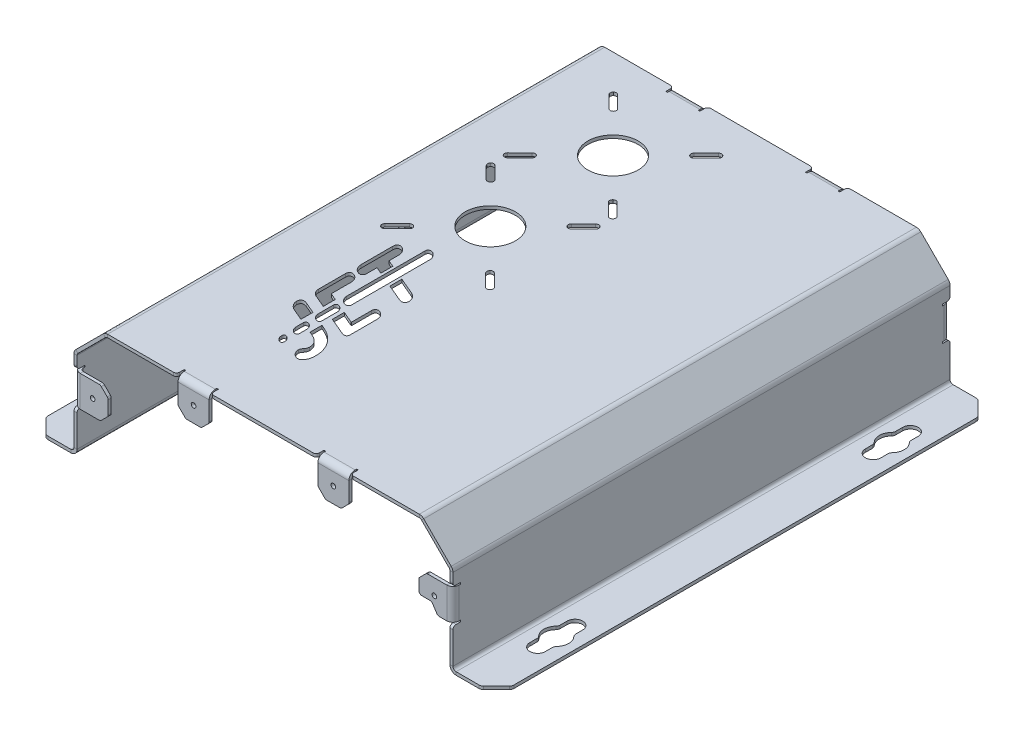
from build123d import *

# Parameters (mm, degrees)
BASE_FLANGE1_DEPTH              = 80
BREAK_CORNER1_START             = -1
BREAK_CORNER1_DEPTH             = 1
CUT_EXTRUDE1_DEPTH              = 10
FILLET1_R                       = 1.5
EDGE_FLANGE2_STRIP_W            = 6
EDGE_FLANGE2_STRIP_H            = 1
EDGE_FLANGE2_STRIP_CUT_DEPTH    = 10
EDGE_FLANGE2_RELIEF_W           = 6.5
EDGE_FLANGE2_RELIEF_H           = 0.5
EDGE_FLANGE2_RELIEF_CUT_DEPTH   = 1
EDGE_FLANGE2_STRIP_2_W          = 6
EDGE_FLANGE2_STRIP_2_H          = 1
EDGE_FLANGE2_STRIP_CUT_2_DEPTH  = 10
EDGE_FLANGE2_RELIEF_2_W         = 6.5
EDGE_FLANGE2_RELIEF_2_H         = 0.5
EDGE_FLANGE2_RELIEF_CUT_2_DEPTH = 1
EDGE_FLANGE2_STRIP_3_W          = 6
EDGE_FLANGE2_STRIP_3_H          = 1
EDGE_FLANGE2_STRIP_CUT_3_DEPTH  = 10
EDGE_FLANGE2_RELIEF_3_W         = 6.5
EDGE_FLANGE2_RELIEF_3_H         = 0.5
EDGE_FLANGE2_RELIEF_CUT_3_DEPTH = 1
EDGE_FLANGE2_DEPTH              = 10
EDGE_FLANGE2_FLAT_DEPTH         = 1
EDGE_FLANGE2_BEND_DEPTH         = 10
EDGE_FLANGE2_FLAT_2_DEPTH       = 1
EDGE_FLANGE2_BEND_2_DEPTH       = 10
EDGE_FLANGE2_FLAT_3_DEPTH       = 1
EDGE_FLANGE3_STRIP_W            = 6
EDGE_FLANGE3_STRIP_H            = 1
EDGE_FLANGE3_STRIP_CUT_DEPTH    = 10
EDGE_FLANGE3_RELIEF_W           = 6.5
EDGE_FLANGE3_RELIEF_H           = 0.5
EDGE_FLANGE3_RELIEF_CUT_DEPTH   = 1
EDGE_FLANGE3_DEPTH              = 10
EDGE_FLANGE3_FLAT_DEPTH         = 1
BREAK_CORNER2_START             = 37
BREAK_CORNER2_DEPTH             = 1
BREAK_CORNER2_START_2           = -80
BREAK_CORNER2_2_DEPTH           = 160
BREAK_CORNER2_START_3           = -61
BREAK_CORNER2_3_DEPTH           = 122
F_1_5_1_5_DIAMETER_HOLE1_D      = 1.5
CUT_EXTRUDE2_DEPTH              = 181.74567768
BREAK_CORNER3_START             = -80
BREAK_CORNER3_DEPTH             = 160
FILLET2_R                       = 1
CUT_EXTRUDE3_DEPTH              = 10
BREAK_CORNER4_START             = -1
BREAK_CORNER4_DEPTH             = 1
SKETCH48_W                      = 28
SKETCH48_H                      = 9
CUT_EXTRUDE4_DEPTH              = 10
SKETCH49_R                      = 8.1
CUT_EXTRUDE5_DEPTH              = 10
FILLET3_R                       = 1


# Read off the part's stored shape, not the designer's step: Break-Corner1, Break-Corner2, Break-Corner3, Break-Corner4
# Sheet-metal steps are written as plain solids
with BuildPart() as part:
    # Sketch1 → Base-Flange1 (new, symmetric)
    with BuildSketch(Plane.XY):
        with BuildLine():
            Line((-75, 0), (-62, 0))
            ThreePointArc((-62, 0), (-61.292893219, 0.292893219), (-61, 1))
            Line((-61, 1), (-61, 27.171572875))
            ThreePointArc((-61, 27.171572875), (-60.847759065, 27.93693974), (-60.414213562, 28.585786438))
            Line((-60.414213562, 28.585786438), (-51.585786438, 37.414213562))
            ThreePointArc((-51.585786438, 37.414213562), (-50.93693974, 37.847759065), (-50.171572875, 38))
            Line((-50.171572875, 38), (50.171572875, 38))
            ThreePointArc((50.171572875, 38), (50.93693974, 37.847759065), (51.585786438, 37.414213562))
            Line((51.585786438, 37.414213562), (60.414213562, 28.585786438))
            ThreePointArc((60.414213562, 28.585786438), (60.847759065, 27.93693974), (61, 27.171572875))
            Line((61, 27.171572875), (61, 1))
            ThreePointArc((61, 1), (61.292893219, 0.292893219), (62, 0))
            Line((62, 0), (75, 0))
            Line((75, 0), (75, -1))
            Line((75, -1), (62, -1))
            ThreePointArc((62, -1), (60.585786438, -0.414213562), (60, 1))
            Line((60, 1), (60, 27.171572875))
            ThreePointArc((60, 27.171572875), (59.923879533, 27.554256308), (59.707106781, 27.878679656))
            Line((59.707106781, 27.878679656), (50.878679656, 36.707106781))
            ThreePointArc((50.878679656, 36.707106781), (50.554256308, 36.923879533), (50.171572875, 37))
            Line((50.171572875, 37), (-50.171572875, 37))
            ThreePointArc((-50.171572875, 37), (-50.554256308, 36.923879533), (-50.878679656, 36.707106781))
            Line((-50.878679656, 36.707106781), (-59.707106781, 27.878679656))
            ThreePointArc((-59.707106781, 27.878679656), (-59.923879533, 27.554256308), (-60, 27.171572875))
            Line((-60, 27.171572875), (-60, 1))
            ThreePointArc((-60, 1), (-60.585786438, -0.414213562), (-62, -1))
            Line((-62, -1), (-75, -1))
            Line((-75, -1), (-75, 0))
        make_face()
    extrude(amount=BASE_FLANGE1_DEPTH, both=True)

    # Break-Corner1 outline → Break-Corner1 (cut)
    with BuildSketch(Plane(origin=(0, 0, 0), x_dir=(1, 0, 0), z_dir=(0, 1, 0)).offset(BREAK_CORNER1_START)):
        Polygon((75, -80), (75, -75), (70, -80), align=None)
        Polygon((70, 80), (75, 75), (75, 80), align=None)
        Polygon((-75, 80), (-75, 75), (-70, 80), align=None)
        Polygon((-70, -80), (-75, -75), (-75, -80), align=None)
    extrude(amount=BREAK_CORNER1_DEPTH, mode=Mode.SUBTRACT)

    # Sketch2 → Cut-Extrude1 (cut)
    with BuildSketch(Plane.XZ):
        with BuildLine():
            ThreePointArc((70.75, 50.877501001), (72.25, 54), (70.75, 57.122498999))
            Line((70.75, 57.122498999), (70.75, 60))
            ThreePointArc((70.75, 60), (68.25, 62.5), (65.75, 60))
            Line((65.75, 60), (65.75, 57.122498999))
            ThreePointArc((65.75, 57.122498999), (64.25, 54), (65.75, 50.877501001))
            Line((65.75, 50.877501001), (65.75, 48))
            ThreePointArc((65.75, 48), (68.25, 45.5), (70.75, 48))
            Line((70.75, 48), (70.75, 50.877501001))
        make_face()
        with BuildLine():
            Line((70.75, -60), (70.75, -57.122498999))
            ThreePointArc((70.75, -57.122498999), (72.25, -54), (70.75, -50.877501001))
            Line((70.75, -50.877501001), (70.75, -48))
            ThreePointArc((70.75, -48), (68.25, -45.5), (65.75, -48))
            Line((65.75, -48), (65.75, -50.877501001))
            ThreePointArc((65.75, -50.877501001), (64.25, -54), (65.75, -57.122498999))
            Line((65.75, -57.122498999), (65.75, -60))
            ThreePointArc((65.75, -60), (68.25, -62.5), (70.75, -60))
        make_face()
        with BuildLine():
            Line((-70.75, 60), (-70.75, 57.122498999))
            ThreePointArc((-70.75, 57.122498999), (-72.25, 54), (-70.75, 50.877501001))
            Line((-70.75, 50.877501001), (-70.75, 48))
            ThreePointArc((-70.75, 48), (-68.25, 45.5), (-65.75, 48))
            Line((-65.75, 48), (-65.75, 50.877501001))
            ThreePointArc((-65.75, 50.877501001), (-64.25, 54), (-65.75, 57.122498999))
            Line((-65.75, 57.122498999), (-65.75, 60))
            ThreePointArc((-65.75, 60), (-68.25, 62.5), (-70.75, 60))
        make_face()
        with BuildLine():
            ThreePointArc((-70.75, -50.877501001), (-72.25, -54), (-70.75, -57.122498999))
            Line((-70.75, -57.122498999), (-70.75, -60))
            ThreePointArc((-70.75, -60), (-68.25, -62.5), (-65.75, -60))
            Line((-65.75, -60), (-65.75, -57.122498999))
            ThreePointArc((-65.75, -57.122498999), (-64.25, -54), (-65.75, -50.877501001))
            Line((-65.75, -50.877501001), (-65.75, -48))
            ThreePointArc((-65.75, -48), (-68.25, -45.5), (-70.75, -48))
            Line((-70.75, -48), (-70.75, -50.877501001))
        make_face()
    extrude(amount=CUT_EXTRUDE1_DEPTH, mode=Mode.SUBTRACT)

    # Fillet1
    fillet1_edges = [part.edges().sort_by_distance(p)[0] for p in [
        (70.75, -0.5, -57.122498999),
        (70.75, -0.5, -50.877501001),
        (65.75, -0.5, -50.877501001),
        (65.75, -0.5, -57.122498999),
        (-70.75, -0.5, 57.122498999),
        (-70.75, -0.5, 50.877501001),
        (-65.75, -0.5, 50.877501001),
        (-65.75, -0.5, 57.122498999),
        (-70.75, -0.5, -50.877501001),
        (-70.75, -0.5, -57.122498999),
        (-65.75, -0.5, -57.122498999),
        (-65.75, -0.5, -50.877501001),
        (70.75, -0.5, 50.877501001),
        (70.75, -0.5, 57.122498999),
        (65.75, -0.5, 57.122498999),
        (65.75, -0.5, 50.877501001),
    ]]
    fillet(fillet1_edges, radius=FILLET1_R)

    # Edge-Flange2 strip (across the edge) → Edge-Flange2 strip cut (cut)
    with BuildSketch(Plane(origin=(17.5, 37, -80), x_dir=(0, 0, 1), z_dir=(1, 0, 0))):
        with Locations((-1, -0.5)):
            Rectangle(EDGE_FLANGE2_STRIP_W, EDGE_FLANGE2_STRIP_H)
    edge_flange2_strip_cut = extrude(amount=EDGE_FLANGE2_STRIP_CUT_DEPTH, mode=Mode.SUBTRACT)

    # Edge-Flange2 relief (on the sheet) → Edge-Flange2 relief cut (cut)
    with BuildSketch(Plane(origin=(17.5, 37, -78), x_dir=(0, 0, 1), z_dir=(0, -1, 0))):
        with Locations((-2.75, 0.25)):
            Rectangle(EDGE_FLANGE2_RELIEF_W, EDGE_FLANGE2_RELIEF_H)
        with Locations((-2.75, -10.25)):
            Rectangle(EDGE_FLANGE2_RELIEF_W, EDGE_FLANGE2_RELIEF_H)
    edge_flange2_relief_cut = extrude(amount=-EDGE_FLANGE2_RELIEF_CUT_DEPTH, mode=Mode.SUBTRACT)

    # Edge-Flange2 strip 2 (across the edge) → Edge-Flange2 strip cut 2 (cut)
    with BuildSketch(Plane(origin=(60, 22.671572875, -80), x_dir=(0, 0, 1), z_dir=(0, -1, 0))):
        with Locations((-1, -0.5)):
            Rectangle(EDGE_FLANGE2_STRIP_2_W, EDGE_FLANGE2_STRIP_2_H)
    edge_flange2_strip_cut_2 = extrude(amount=EDGE_FLANGE2_STRIP_CUT_2_DEPTH, mode=Mode.SUBTRACT)

    # Edge-Flange2 relief 2 (on the sheet) → Edge-Flange2 relief cut 2 (cut)
    with BuildSketch(Plane(origin=(60, 22.671572875, -78), x_dir=(0, 0, 1), z_dir=(-1, 0, 0))):
        with Locations((-2.75, 0.25)):
            Rectangle(EDGE_FLANGE2_RELIEF_2_W, EDGE_FLANGE2_RELIEF_2_H)
        with Locations((-2.75, -10.25)):
            Rectangle(EDGE_FLANGE2_RELIEF_2_W, EDGE_FLANGE2_RELIEF_2_H)
    edge_flange2_relief_cut_2 = extrude(amount=-EDGE_FLANGE2_RELIEF_CUT_2_DEPTH, mode=Mode.SUBTRACT)

    # Edge-Flange2 strip 3 (across the edge) → Edge-Flange2 strip cut 3 (cut)
    with BuildSketch(Plane(origin=(-60, 12.671572875, -80), x_dir=(0, 0, 1), z_dir=(0, 1, 0))):
        with Locations((-1, -0.5)):
            Rectangle(EDGE_FLANGE2_STRIP_3_W, EDGE_FLANGE2_STRIP_3_H)
    edge_flange2_strip_cut_3 = extrude(amount=EDGE_FLANGE2_STRIP_CUT_3_DEPTH, mode=Mode.SUBTRACT)

    # Edge-Flange2 relief 3 (on the sheet) → Edge-Flange2 relief cut 3 (cut)
    with BuildSketch(Plane(origin=(-60, 12.671572875, -78), x_dir=(0, 0, 1), z_dir=(1, 0, 0))):
        with Locations((-2.75, 0.25)):
            Rectangle(EDGE_FLANGE2_RELIEF_3_W, EDGE_FLANGE2_RELIEF_3_H)
        with Locations((-2.75, -10.25)):
            Rectangle(EDGE_FLANGE2_RELIEF_3_W, EDGE_FLANGE2_RELIEF_3_H)
    edge_flange2_relief_cut_3 = extrude(amount=-EDGE_FLANGE2_RELIEF_CUT_3_DEPTH, mode=Mode.SUBTRACT)

    # Edge-Flange2 bend section (across the edge) → Edge-Flange2 (add)
    with BuildSketch(Plane(origin=(17.5, 37, -80), x_dir=(0, 0, 1), z_dir=(1, 0, 0))):
        with BuildLine():
            Line((0, 1), (1, 1))
            ThreePointArc((1, 1), (1.292893219, 0.292893219), (2, 0))
            Line((2, 0), (2, -1))
            ThreePointArc((2, -1), (0.585786438, -0.414213562), (0, 1))
        make_face()
    edge_flange2 = extrude(amount=EDGE_FLANGE2_DEPTH)

    # Edge-Flange2 profile (on flange) → Edge-Flange2 flat (add)
    with BuildSketch(Plane(origin=(0, 37, -80), x_dir=(1, 0, 0), z_dir=(0, 0, -1))):
        Polygon((17.5, 7.5), (17.5, 1), (27.5, 1), (27.5, 7.5), (25, 10), (20, 10), align=None)
    edge_flange2_flat = extrude(amount=-EDGE_FLANGE2_FLAT_DEPTH)

    # Edge-Flange2 bend section 2 (across the edge) → Edge-Flange2 bend (add)
    with BuildSketch(Plane(origin=(60, 22.671572875, -80), x_dir=(0, 0, 1), z_dir=(0, -1, 0))):
        with BuildLine():
            Line((0, 1), (1, 1))
            ThreePointArc((1, 1), (1.292893219, 0.292893219), (2, 0))
            Line((2, 0), (2, -1))
            ThreePointArc((2, -1), (0.585786438, -0.414213562), (0, 1))
        make_face()
    edge_flange2_bend = extrude(amount=EDGE_FLANGE2_BEND_DEPTH)

    # Edge-Flange2 profile 2 (on flange) → Edge-Flange2 flat 2 (add)
    with BuildSketch(Plane(origin=(60, 0, -80), x_dir=(0, -1, 0), z_dir=(0, 0, -1))):
        Polygon((-22.671572875, 7.5), (-22.671572875, 1), (-12.671572875, 1), (-12.671572875, 7.5), (-15.171572875, 10), (-20.171572875, 10), align=None)
    edge_flange2_flat_2 = extrude(amount=-EDGE_FLANGE2_FLAT_2_DEPTH)

    # Edge-Flange2 bend section 3 (across the edge) → Edge-Flange2 bend 2 (add)
    with BuildSketch(Plane(origin=(-60, 12.671572875, -80), x_dir=(0, 0, 1), z_dir=(0, 1, 0))):
        with BuildLine():
            Line((0, 1), (1, 1))
            ThreePointArc((1, 1), (1.292893219, 0.292893219), (2, 0))
            Line((2, 0), (2, -1))
            ThreePointArc((2, -1), (0.585786438, -0.414213562), (0, 1))
        make_face()
    edge_flange2_bend_2 = extrude(amount=EDGE_FLANGE2_BEND_2_DEPTH)

    # Edge-Flange2 profile 3 (on flange) → Edge-Flange2 flat 3 (add)
    with BuildSketch(Plane(origin=(-60, 0, -80), x_dir=(0, 1, 0), z_dir=(0, 0, -1))):
        Polygon((12.671572875, 7.5), (12.671572875, 1), (22.671572875, 1), (22.671572875, 7.5), (20.171572875, 10), (15.171572875, 10), align=None)
    edge_flange2_flat_3 = extrude(amount=-EDGE_FLANGE2_FLAT_3_DEPTH)

    # Edge-Flange3 strip (across the edge) → Edge-Flange3 strip cut (cut)
    with BuildSketch(Plane(origin=(-27.5, 37, -80), x_dir=(0, 0, 1), z_dir=(1, 0, 0))):
        with Locations((-1, -0.5)):
            Rectangle(EDGE_FLANGE3_STRIP_W, EDGE_FLANGE3_STRIP_H)
    edge_flange3_strip_cut = extrude(amount=EDGE_FLANGE3_STRIP_CUT_DEPTH, mode=Mode.SUBTRACT)

    # Edge-Flange3 relief (on the sheet) → Edge-Flange3 relief cut (cut)
    with BuildSketch(Plane(origin=(-27.5, 37, -78), x_dir=(0, 0, 1), z_dir=(0, -1, 0))):
        with Locations((-2.75, 0.25)):
            Rectangle(EDGE_FLANGE3_RELIEF_W, EDGE_FLANGE3_RELIEF_H)
        with Locations((-2.75, -10.25)):
            Rectangle(EDGE_FLANGE3_RELIEF_W, EDGE_FLANGE3_RELIEF_H)
    edge_flange3_relief_cut = extrude(amount=-EDGE_FLANGE3_RELIEF_CUT_DEPTH, mode=Mode.SUBTRACT)

    # Edge-Flange3 bend section (across the edge) → Edge-Flange3 (add)
    with BuildSketch(Plane(origin=(-27.5, 37, -80), x_dir=(0, 0, 1), z_dir=(1, 0, 0))):
        with BuildLine():
            Line((0, 1), (1, 1))
            ThreePointArc((1, 1), (1.292893219, 0.292893219), (2, 0))
            Line((2, 0), (2, -1))
            ThreePointArc((2, -1), (0.585786438, -0.414213562), (0, 1))
        make_face()
    edge_flange3 = extrude(amount=EDGE_FLANGE3_DEPTH)

    # Edge-Flange3 profile (on flange) → Edge-Flange3 flat (add)
    with BuildSketch(Plane(origin=(0, 37, -80), x_dir=(1, 0, 0), z_dir=(0, 0, -1))):
        Polygon((-27.5, 1), (-17.5, 1), (-17.5, 7.5), (-20, 10), (-25, 10), (-27.5, 7.5), align=None)
    edge_flange3_flat = extrude(amount=-EDGE_FLANGE3_FLAT_DEPTH)

    # Mirror1: Edge-Flange2 strip cut, Edge-Flange2 relief cut, Edge-Flange2 strip cut 2, Edge-Flange2 relief cut 2, Edge-Flange2 strip cut 3, Edge-Flange2 relief cut 3, Edge-Flange2, Edge-Flange2 flat, Edge-Flange2 bend, Edge-Flange2 flat 2, Edge-Flange2 bend 2, Edge-Flange2 flat 3, Edge-Flange3 strip cut, Edge-Flange3 relief cut, Edge-Flange3, Edge-Flange3 flat across plane
    add(edge_flange2_strip_cut.mirror(Plane.XY), mode=Mode.SUBTRACT)
    add(edge_flange2_relief_cut.mirror(Plane.XY), mode=Mode.SUBTRACT)
    add(edge_flange2_strip_cut_2.mirror(Plane.XY), mode=Mode.SUBTRACT)
    add(edge_flange2_relief_cut_2.mirror(Plane.XY), mode=Mode.SUBTRACT)
    add(edge_flange2_strip_cut_3.mirror(Plane.XY), mode=Mode.SUBTRACT)
    add(edge_flange2_relief_cut_3.mirror(Plane.XY), mode=Mode.SUBTRACT)
    add(edge_flange2.mirror(Plane.XY))
    add(edge_flange2_flat.mirror(Plane.XY))
    add(edge_flange2_bend.mirror(Plane.XY))
    add(edge_flange2_flat_2.mirror(Plane.XY))
    add(edge_flange2_bend_2.mirror(Plane.XY))
    add(edge_flange2_flat_3.mirror(Plane.XY))
    add(edge_flange3_strip_cut.mirror(Plane.XY), mode=Mode.SUBTRACT)
    add(edge_flange3_relief_cut.mirror(Plane.XY), mode=Mode.SUBTRACT)
    add(edge_flange3.mirror(Plane.XY))
    add(edge_flange3_flat.mirror(Plane.XY))

    # Break-Corner2 outline → Break-Corner2 (cut)
    with BuildSketch(Plane(origin=(0, 0, 0), x_dir=(1, 0, 0), z_dir=(0, 1, 0)).offset(BREAK_CORNER2_START)):
        with BuildLine():
            Line((-17, -80), (-16, -80))
            ThreePointArc((-16, -80), (-16.707106781, -79.707106781), (-17, -79))
            Line((-17, -79), (-17, -80))
        make_face()
        with BuildLine():
            ThreePointArc((17, -79), (16.707106781, -79.707106781), (16, -80))
            Line((16, -80), (17, -80))
            Line((17, -80), (17, -79))
        make_face()
        with BuildLine():
            ThreePointArc((29, -80), (28.292893219, -79.707106781), (28, -79))
            Line((28, -79), (28, -80))
            Line((28, -80), (29, -80))
        make_face()
        with BuildLine():
            ThreePointArc((-28, -79), (-28.292893219, -79.707106781), (-29, -80))
            Line((-29, -80), (-28, -80))
            Line((-28, -80), (-28, -79))
        make_face()
        with BuildLine():
            ThreePointArc((-29, 80), (-28.292893219, 79.707106781), (-28, 79))
            Line((-28, 79), (-28, 80))
            Line((-28, 80), (-29, 80))
        make_face()
        with BuildLine():
            Line((17, 80), (16, 80))
            ThreePointArc((16, 80), (16.707106781, 79.707106781), (17, 79))
            Line((17, 79), (17, 80))
        make_face()
        with BuildLine():
            ThreePointArc((-17, 79), (-16.707106781, 79.707106781), (-16, 80))
            Line((-16, 80), (-17, 80))
            Line((-17, 80), (-17, 79))
        make_face()
        with BuildLine():
            ThreePointArc((28, 79), (28.292893219, 79.707106781), (29, 80))
            Line((29, 80), (28, 80))
            Line((28, 80), (28, 79))
        make_face()
    extrude(amount=BREAK_CORNER2_DEPTH, mode=Mode.SUBTRACT)

    # Break-Corner2 2 outline → Break-Corner2 2 (cut)
    with BuildSketch(Plane.XY.offset(BREAK_CORNER2_START_2)):
        with BuildLine():
            Line((52.5, 12.671572875), (52.914213562, 12.671572875))
            ThreePointArc((52.914213562, 12.671572875), (52.53153013, 12.747693343), (52.207106781, 12.964466094))
            Line((52.207106781, 12.964466094), (52.5, 12.671572875))
        make_face()
        with BuildLine():
            Line((52.5, 22.671572875), (52.207106781, 22.378679656))
            ThreePointArc((52.207106781, 22.378679656), (52.53153013, 22.595452408), (52.914213562, 22.671572875))
            Line((52.914213562, 22.671572875), (52.5, 22.671572875))
        make_face()
        with BuildLine():
            Line((50, 20.171572875), (50, 19.757359313))
            ThreePointArc((50, 19.757359313), (50.076120467, 20.140042745), (50.292893219, 20.464466094))
            Line((50.292893219, 20.464466094), (50, 20.171572875))
        make_face()
        with BuildLine():
            Line((50, 15.171572875), (50.292893219, 14.878679656))
            ThreePointArc((50.292893219, 14.878679656), (50.076120467, 15.203103005), (50, 15.585786438))
            Line((50, 15.585786438), (50, 15.171572875))
        make_face()
        with BuildLine():
            Line((27.5, 29.5), (27.5, 29.914213562))
            ThreePointArc((27.5, 29.914213562), (27.423879533, 29.53153013), (27.207106781, 29.207106781))
            Line((27.207106781, 29.207106781), (27.5, 29.5))
        make_face()
        with BuildLine():
            Line((17.5, 29.5), (17.792893219, 29.207106781))
            ThreePointArc((17.792893219, 29.207106781), (17.576120467, 29.53153013), (17.5, 29.914213562))
            Line((17.5, 29.914213562), (17.5, 29.5))
        make_face()
        with BuildLine():
            Line((20, 27), (20.414213562, 27))
            ThreePointArc((20.414213562, 27), (20.03153013, 27.076120467), (19.707106781, 27.292893219))
            Line((19.707106781, 27.292893219), (20, 27))
        make_face()
        with BuildLine():
            Line((25, 27), (25.292893219, 27.292893219))
            ThreePointArc((25.292893219, 27.292893219), (24.96846987, 27.076120467), (24.585786438, 27))
            Line((24.585786438, 27), (25, 27))
        make_face()
        with BuildLine():
            Line((-17.5, 29.5), (-17.5, 29.914213562))
            ThreePointArc((-17.5, 29.914213562), (-17.576120467, 29.53153013), (-17.792893219, 29.207106781))
            Line((-17.792893219, 29.207106781), (-17.5, 29.5))
        make_face()
        with BuildLine():
            Line((-27.5, 29.5), (-27.207106781, 29.207106781))
            ThreePointArc((-27.207106781, 29.207106781), (-27.423879533, 29.53153013), (-27.5, 29.914213562))
            Line((-27.5, 29.914213562), (-27.5, 29.5))
        make_face()
        with BuildLine():
            Line((-25, 27), (-24.585786438, 27))
            ThreePointArc((-24.585786438, 27), (-24.96846987, 27.076120467), (-25.292893219, 27.292893219))
            Line((-25.292893219, 27.292893219), (-25, 27))
        make_face()
        with BuildLine():
            Line((-20, 27), (-19.707106781, 27.292893219))
            ThreePointArc((-19.707106781, 27.292893219), (-20.03153013, 27.076120467), (-20.414213562, 27))
            Line((-20.414213562, 27), (-20, 27))
        make_face()
        with BuildLine():
            Line((-52.5, 22.671572875), (-52.914213562, 22.671572875))
            ThreePointArc((-52.914213562, 22.671572875), (-52.53153013, 22.595452408), (-52.207106781, 22.378679656))
            Line((-52.207106781, 22.378679656), (-52.5, 22.671572875))
        make_face()
        with BuildLine():
            Line((-52.5, 12.671572875), (-52.207106781, 12.964466094))
            ThreePointArc((-52.207106781, 12.964466094), (-52.53153013, 12.747693343), (-52.914213562, 12.671572875))
            Line((-52.914213562, 12.671572875), (-52.5, 12.671572875))
        make_face()
        with BuildLine():
            Line((-50, 15.171572875), (-50, 15.585786438))
            ThreePointArc((-50, 15.585786438), (-50.076120467, 15.203103005), (-50.292893219, 14.878679656))
            Line((-50.292893219, 14.878679656), (-50, 15.171572875))
        make_face()
        with BuildLine():
            Line((-50, 20.171572875), (-50.292893219, 20.464466094))
            ThreePointArc((-50.292893219, 20.464466094), (-50.076120467, 20.140042745), (-50, 19.757359313))
            Line((-50, 19.757359313), (-50, 20.171572875))
        make_face()
    extrude(amount=BREAK_CORNER2_2_DEPTH, mode=Mode.SUBTRACT)

    # Break-Corner2 3 outline → Break-Corner2 3 (cut)
    with BuildSketch(Plane.YZ.offset(BREAK_CORNER2_START_3)):
        with BuildLine():
            Line((12.171572875, -80), (12.171572875, -79))
            ThreePointArc((12.171572875, -79), (11.878679656, -79.707106781), (11.171572875, -80))
            Line((11.171572875, -80), (12.171572875, -80))
        make_face()
        with BuildLine():
            Line((23.171572875, -80), (24.171572875, -80))
            ThreePointArc((24.171572875, -80), (23.464466094, -79.707106781), (23.171572875, -79))
            Line((23.171572875, -79), (23.171572875, -80))
        make_face()
        with BuildLine():
            Line((23.171572875, 80), (23.171572875, 79))
            ThreePointArc((23.171572875, 79), (23.464466094, 79.707106781), (24.171572875, 80))
            Line((24.171572875, 80), (23.171572875, 80))
        make_face()
        with BuildLine():
            Line((12.171572875, 80), (11.171572875, 80))
            ThreePointArc((11.171572875, 80), (11.878679656, 79.707106781), (12.171572875, 79))
            Line((12.171572875, 79), (12.171572875, 80))
        make_face()
    extrude(amount=BREAK_CORNER2_3_DEPTH, mode=Mode.SUBTRACT)

    # Ø1.5 (1.5) Diameter Hole1 (through all)
    with Locations(Plane(origin=(0, 0, -80), x_dir=(-1, 0, 0), z_dir=(0, 0, -1))):
        with Locations((-22.5, 32), (-55, 17.671572875), (55, 17.671572875), (22.5, 32)):
            Hole(F_1_5_1_5_DIAMETER_HOLE1_D / 2)

    # Sketch43 → Cut-Extrude2 (cut, through all)
    with BuildSketch(Plane.XY.offset(80)):
        with BuildLine():
            Line((50, 15.671572875), (54.1, 15.671572875))
            Line((54.1, 15.671572875), (56.114213562, 12.671572875))
            Line((56.114213562, 12.671572875), (52.914213562, 12.671572875))
            ThreePointArc((52.914213562, 12.671572875), (52.53153013, 12.747693343), (52.207106781, 12.964466094))
            Line((52.207106781, 12.964466094), (50.292893219, 14.878679656))
            ThreePointArc((50.292893219, 14.878679656), (50.076120467, 15.203103005), (50, 15.585786438))
            Line((50, 15.585786438), (50, 15.671572875))
        make_face()
    extrude(amount=-CUT_EXTRUDE2_DEPTH, mode=Mode.SUBTRACT)

    # Break-Corner3 outline → Break-Corner3 (cut)
    with BuildSketch(Plane.XY.offset(BREAK_CORNER3_START)):
        with BuildLine():
            ThreePointArc((56.647294006, 12.671572875), (56.176879522, 12.789127289), (55.817063635, 13.11415245))
            Line((55.817063635, 13.11415245), (56.114213562, 12.671572875))
            Line((56.114213562, 12.671572875), (56.647294006, 12.671572875))
        make_face()
        with BuildLine():
            Line((50, 15.671572875), (51, 15.671572875))
            ThreePointArc((51, 15.671572875), (50.292893219, 15.964466094), (50, 16.671572875))
            Line((50, 16.671572875), (50, 15.671572875))
        make_face()
    extrude(amount=BREAK_CORNER3_DEPTH, mode=Mode.SUBTRACT)

    # Fillet2
    fillet2_edges = [part.edges().sort_by_distance(p)[0] for p in [
        (54.1, 15.671572875, -79.5),
        (54.1, 15.671572875, 79.5),
    ]]
    fillet(fillet2_edges, radius=FILLET2_R)

    # Sketch46 → Cut-Extrude3 (cut)
    with BuildSketch(Plane(origin=(0, 38, 0), x_dir=(1, 0, 0), z_dir=(0, 1, 0))):
        with BuildLine():
            Line((-22.2965, -5.7161), (-22.2965, -30.9521))
            add(Edge.make_bspline(
                [(-22.2965, -30.9521), (-22.2965, -31.8418), (-21.5688, -32.9225), (-20.6793, -33.354)],
                knots=[0.777777778, 0.777777778, 0.777777778, 0.777777778, 1, 1, 1, 1], degree=3))
            add(Edge.make_bspline(
                [(-20.6793, -33.354), (-19.7895, -33.7856), (-19.0618, -33.4108), (-19.0618, -32.5212)],
                knots=[0.555555556, 0.555555556, 0.555555556, 0.555555556, 0.666666667, 0.666666667, 0.666666667, 0.666666667], degree=3))
            Line((-19.0618, -32.5212), (-19.0618, -7.2852))
            add(Edge.make_bspline(
                [(-19.0618, -7.2852), (-19.0618, -6.3955), (-19.7895, -5.3148), (-20.6793, -4.8832)],
                knots=[0.333333333, 0.333333333, 0.333333333, 0.333333333, 0.444444444, 0.444444444, 0.444444444, 0.444444444], degree=3))
            add(Edge.make_bspline(
                [(-20.6793, -4.8832), (-21.5688, -4.4517), (-22.2965, -4.8264), (-22.2965, -5.7161)],
                knots=[0.111111111, 0.111111111, 0.111111111, 0.111111111, 0.222222222, 0.222222222, 0.222222222, 0.222222222], degree=3))
        make_face()
        with BuildLine():
            Line((-21.8812, -45.3084), (-21.8812, -47.7576))
            add(Edge.make_bspline(
                [(-21.8812, -47.7576), (-21.8812, -48.4187), (-21.3403, -49.2219), (-20.6793, -49.5426)],
                knots=[0.777777778, 0.777777778, 0.777777778, 0.777777778, 1, 1, 1, 1], degree=3))
            add(Edge.make_bspline(
                [(-20.6793, -49.5426), (-20.0179, -49.8634), (-19.4771, -49.5849), (-19.4771, -48.9238)],
                knots=[0.555555556, 0.555555556, 0.555555556, 0.555555556, 0.666666667, 0.666666667, 0.666666667, 0.666666667], degree=3))
            Line((-19.4771, -48.9238), (-19.4771, -46.4746))
            add(Edge.make_bspline(
                [(-19.4771, -46.4746), (-19.4771, -45.8135), (-20.0179, -45.0102), (-20.679, -44.6896)],
                knots=[0.333333333, 0.333333333, 0.333333333, 0.333333333, 0.444444444, 0.444444444, 0.444444444, 0.444444444], degree=3))
            add(Edge.make_bspline(
                [(-20.679, -44.6896), (-21.3403, -44.3688), (-21.8812, -44.6473), (-21.8812, -45.3084)],
                knots=[0.111111111, 0.111111111, 0.111111111, 0.111111111, 0.222222222, 0.222222222, 0.222222222, 0.222222222], degree=3))
        make_face()
        with BuildLine():
            Line((-21.7302, -52.3392), (-21.7302, -52.6821))
            add(Edge.make_bspline(
                [(-21.7302, -52.6821), (-21.7302, -53.2602), (-21.2573, -53.9625), (-20.6792, -54.2429)],
                knots=[0.777777778, 0.777777778, 0.777777778, 0.777777778, 1, 1, 1, 1], degree=3))
            add(Edge.make_bspline(
                [(-20.6792, -54.2429), (-20.101, -54.5234), (-19.6281, -54.2799), (-19.6281, -53.7018)],
                knots=[0.555555556, 0.555555556, 0.555555556, 0.555555556, 0.666666667, 0.666666667, 0.666666667, 0.666666667], degree=3))
            Line((-19.6281, -53.7018), (-19.6281, -53.3589))
            add(Edge.make_bspline(
                [(-19.6281, -53.3589), (-19.6281, -52.7808), (-20.101, -52.0785), (-20.679, -51.7981)],
                knots=[0.333333333, 0.333333333, 0.333333333, 0.333333333, 0.444444444, 0.444444444, 0.444444444, 0.444444444], degree=3))
            add(Edge.make_bspline(
                [(-20.679, -51.7981), (-21.2573, -51.5176), (-21.7302, -51.7611), (-21.7302, -52.3392)],
                knots=[0.111111111, 0.111111111, 0.111111111, 0.111111111, 0.222222222, 0.222222222, 0.222222222, 0.222222222], degree=3))
        make_face()
        with BuildLine():
            Line((-21.9596, -35.5348), (-21.9596, -40.5072))
            add(Edge.make_bspline(
                [(-21.9596, -40.5072), (-21.9596, -41.2114), (-21.3835, -42.067), (-20.6793, -42.4086)],
                knots=[0.777777778, 0.777777778, 0.777777778, 0.777777778, 1, 1, 1, 1], degree=3))
            add(Edge.make_bspline(
                [(-20.6793, -42.4086), (-19.9748, -42.7503), (-19.3987, -42.4537), (-19.3987, -41.7494)],
                knots=[0.555555556, 0.555555556, 0.555555556, 0.555555556, 0.666666667, 0.666666667, 0.666666667, 0.666666667], degree=3))
            Line((-19.3987, -41.7494), (-19.3987, -36.777))
            add(Edge.make_bspline(
                [(-19.3987, -36.777), (-19.3987, -36.0727), (-19.9748, -35.2171), (-20.679, -34.8755)],
                knots=[0.333333333, 0.333333333, 0.333333333, 0.333333333, 0.444444444, 0.444444444, 0.444444444, 0.444444444], degree=3))
            add(Edge.make_bspline(
                [(-20.679, -34.8755), (-21.3835, -34.5337), (-21.9596, -34.8305), (-21.9596, -35.5348)],
                knots=[0.111111111, 0.111111111, 0.111111111, 0.111111111, 0.222222222, 0.222222222, 0.222222222, 0.222222222], degree=3))
        make_face()
        with BuildLine():
            Line((-18.1512, -43.0097), (-18.1512, -46.866))
            Line((-18.1512, -46.866), (-17.0844, -47.3188))
            add(Edge.make_bspline(
                [(-17.0844, -47.3188), (-14.8806, -48.2541), (-14.0671, -49.5705), (-14.0671, -51.0399)],
                knots=[0.416666667, 0.416666667, 0.416666667, 0.416666667, 0.5, 0.5, 0.5, 0.5], degree=3))
            add(Edge.make_bspline(
                [(-14.0671, -51.0399), (-14.0671, -51.6172), (-14.2507, -52.1425), (-14.5394, -52.4395)],
                knots=[0.5, 0.5, 0.5, 0.5, 0.583333333, 0.583333333, 0.583333333, 0.583333333], degree=3))
            add(Edge.make_bspline(
                [(-14.5394, -52.4395), (-14.9326, -52.8499), (-15.1167, -53.1916), (-15.1167, -53.6639)],
                knots=[0.583333333, 0.583333333, 0.583333333, 0.583333333, 0.666666667, 0.666666667, 0.666666667, 0.666666667], degree=3))
            add(Edge.make_bspline(
                [(-15.1167, -53.6639), (-15.1167, -54.6345), (-14.4083, -55.6701), (-13.4898, -56.0597)],
                knots=[0.666666667, 0.666666667, 0.666666667, 0.666666667, 0.75, 0.75, 0.75, 0.75], degree=3))
            add(Edge.make_bspline(
                [(-13.4898, -56.0597), (-13.0175, -56.2605), (-12.5452, -56.2768), (-12.1515, -56.1029)],
                knots=[0.75, 0.75, 0.75, 0.75, 0.833333333, 0.833333333, 0.833333333, 0.833333333], degree=3))
            add(Edge.make_bspline(
                [(-12.1515, -56.1029), (-11.312, -55.7241), (-10.6561, -54.271), (-10.6561, -52.618)],
                knots=[0, 0, 0, 0, 0.083333333, 0.083333333, 0.083333333, 0.083333333], degree=3))
            add(Edge.make_bspline(
                [(-10.6561, -52.618), (-10.6561, -48.5251), (-12.965, -45.2103), (-17.3466, -43.3509)],
                knots=[0.083333333, 0.083333333, 0.083333333, 0.083333333, 0.166666667, 0.166666667, 0.166666667, 0.166666667], degree=3))
            Line((-17.3466, -43.3509), (-18.1512, -43.0097))
        make_face()
        with BuildLine():
            Line((-23.2073, -33.6757), (-25.2967, -32.7888))
            add(Edge.make_bspline(
                [(-25.2967, -32.7888), (-25.4018, -32.7446), (-25.4543, -32.6698), (-25.4543, -32.5647)],
                knots=[0.1, 0.1, 0.1, 0.1, 0.2, 0.2, 0.2, 0.2], degree=3))
            Line((-25.4543, -32.5647), (-25.4543, -26.2415))
            add(Edge.make_bspline(
                [(-25.4543, -26.2415), (-25.4543, -25.1658), (-26.1627, -24.1567), (-27.1073, -23.756)],
                knots=[0.3, 0.3, 0.3, 0.3, 0.4, 0.4, 0.4, 0.4], degree=3))
            add(Edge.make_bspline(
                [(-27.1073, -23.756), (-28.0779, -23.3441), (-28.7863, -23.7518), (-28.7863, -24.8274)],
                knots=[0.4, 0.4, 0.4, 0.4, 0.5, 0.5, 0.5, 0.5], degree=3))
            Line((-28.7863, -24.8274), (-28.7863, -33.486))
            add(Edge.make_bspline(
                [(-28.7863, -33.486), (-28.7863, -34.5352), (-28.1039, -35.4546), (-27.0808, -35.8888)],
                knots=[0.6, 0.6, 0.6, 0.6, 0.7, 0.7, 0.7, 0.7], degree=3))
            Line((-27.0808, -35.8888), (-23.2073, -37.5325))
            Line((-23.2073, -37.5325), (-23.2073, -33.6757))
        make_face()
        with BuildLine():
            Line((-18.134, -35.8279), (-18.1512, -35.82))
            Line((-18.1512, -35.82), (-18.1512, -39.6777))
            Line((-18.1512, -39.6777), (-12.6503, -42.0117))
            add(Edge.make_bspline(
                [(-12.6503, -42.0117), (-11.6272, -42.4459), (-10.9448, -42.1056), (-10.9448, -41.0565)],
                knots=[0, 0, 0, 0, 0.090909091, 0.090909091, 0.090909091, 0.090909091], degree=3))
            Line((-10.9448, -41.0565), (-10.9448, -32.3979))
            add(Edge.make_bspline(
                [(-10.9448, -32.3979), (-10.9448, -31.3222), (-11.6532, -30.313), (-12.6238, -29.9012)],
                knots=[0.181818182, 0.181818182, 0.181818182, 0.181818182, 0.272727273, 0.272727273, 0.272727273, 0.272727273], degree=3))
            add(Edge.make_bspline(
                [(-12.6238, -29.9012), (-13.5683, -29.5005), (-14.2768, -29.9082), (-14.2768, -30.9838)],
                knots=[0.272727273, 0.272727273, 0.272727273, 0.272727273, 0.363636364, 0.363636364, 0.363636364, 0.363636364], degree=3))
            Line((-14.2768, -30.9838), (-14.2768, -37.307))
            add(Edge.make_bspline(
                [(-14.2768, -37.307), (-14.2768, -37.4121), (-14.3293, -37.4423), (-14.4343, -37.3977)],
                knots=[0.454545455, 0.454545455, 0.454545455, 0.454545455, 0.545454545, 0.545454545, 0.545454545, 0.545454545], degree=3))
            Line((-14.4343, -37.3977), (-18.134, -35.8279))
        make_face()
        with BuildLine():
            Line((-23.2073, -15.1513), (-25.1917, -14.3095))
            add(Edge.make_bspline(
                [(-25.1917, -14.3095), (-25.2967, -14.2649), (-25.3493, -14.19), (-25.3493, -14.0854)],
                knots=[0.076923077, 0.076923077, 0.076923077, 0.076923077, 0.153846154, 0.153846154, 0.153846154, 0.153846154], degree=3))
            Line((-25.3493, -14.0854), (-25.3493, -11.0681))
            add(Edge.make_bspline(
                [(-25.3493, -11.0681), (-25.3493, -9.8874), (-26.0577, -8.8262), (-27.0548, -8.4032)],
                knots=[0.230769231, 0.230769231, 0.230769231, 0.230769231, 0.307692308, 0.307692308, 0.307692308, 0.307692308], degree=3))
            add(Edge.make_bspline(
                [(-27.0548, -8.4032), (-28.0779, -7.969), (-28.7863, -8.4292), (-28.7863, -9.6099)],
                knots=[0.307692308, 0.307692308, 0.307692308, 0.307692308, 0.384615385, 0.384615385, 0.384615385, 0.384615385], degree=3))
            Line((-28.7863, -9.6099), (-28.7863, -19.816))
            add(Edge.make_bspline(
                [(-28.7863, -19.816), (-28.7863, -20.9967), (-28.0779, -22.0584), (-27.0548, -22.4925)],
                knots=[0.461538462, 0.461538462, 0.461538462, 0.461538462, 0.538461538, 0.538461538, 0.538461538, 0.538461538], degree=3))
            add(Edge.make_bspline(
                [(-27.0548, -22.4925), (-26.0577, -22.9156), (-25.3493, -22.4549), (-25.3493, -21.2742)],
                knots=[0.538461538, 0.538461538, 0.538461538, 0.538461538, 0.615384615, 0.615384615, 0.615384615, 0.615384615], degree=3))
            Line((-25.3493, -21.2742), (-25.3493, -18.2569))
            add(Edge.make_bspline(
                [(-25.3493, -18.2569), (-25.3493, -18.1519), (-25.2967, -18.1221), (-25.1917, -18.1667)],
                knots=[0.692307692, 0.692307692, 0.692307692, 0.692307692, 0.769230769, 0.769230769, 0.769230769, 0.769230769], degree=3))
            Line((-25.1917, -18.1667), (-23.2073, -19.0086))
            Line((-23.2073, -19.0086), (-23.2073, -15.1513))
        make_face()
        with BuildLine():
            Line((-18.1512, -17.2965), (-18.1512, -21.1538))
            Line((-18.1512, -21.1538), (-12.8339, -23.4101))
            add(Edge.make_bspline(
                [(-12.8339, -23.4101), (-11.6007, -23.9336), (-10.7872, -23.465), (-10.7872, -22.3629)],
                knots=[0.666666667, 0.666666667, 0.666666667, 0.666666667, 1, 1, 1, 1], degree=3))
            add(Edge.make_bspline(
                [(-10.7872, -22.3629), (-10.7872, -21.2347), (-11.6007, -20.0763), (-12.8339, -19.5529)],
                knots=[0, 0, 0, 0, 0.166666667, 0.166666667, 0.166666667, 0.166666667], degree=3))
            Line((-12.8339, -19.5529), (-18.1512, -17.2965))
        make_face()
        with BuildLine():
            Line((-26.8972, -43.1557), (-23.2073, -44.7213))
            Line((-23.2073, -44.7213), (-23.2073, -40.8645))
            Line((-23.2073, -40.8645), (-26.8972, -39.2989))
            add(Edge.make_bspline(
                [(-26.8972, -39.2989), (-28.1565, -38.7643), (-28.9439, -39.2436), (-28.9439, -40.3717)],
                knots=[0.166666667, 0.166666667, 0.166666667, 0.166666667, 0.333333333, 0.333333333, 0.333333333, 0.333333333], degree=3))
            add(Edge.make_bspline(
                [(-28.9439, -40.3717), (-28.9439, -41.4739), (-28.1565, -42.6211), (-26.8972, -43.1557)],
                knots=[0.333333333, 0.333333333, 0.333333333, 0.333333333, 0.5, 0.5, 0.5, 0.5], degree=3))
        make_face()
    extrude(amount=-CUT_EXTRUDE3_DEPTH, mode=Mode.SUBTRACT)

    # Break-Corner4 outline → Break-Corner4 (cut)
    with BuildSketch(Plane(origin=(0, 0, 0), x_dir=(1, 0, 0), z_dir=(0, 1, 0)).offset(BREAK_CORNER4_START)):
        with BuildLine():
            Line((-70, 80), (-70.439339828, 79.560660172))
            ThreePointArc((-70.439339828, 79.560660172), (-69.952704805, 79.885819299), (-69.378679656, 80))
            Line((-69.378679656, 80), (-70, 80))
        make_face()
        with BuildLine():
            ThreePointArc((-69.378679656, -80), (-69.952704805, -79.885819299), (-70.439339828, -79.560660172))
            Line((-70.439339828, -79.560660172), (-70, -80))
            Line((-70, -80), (-69.378679656, -80))
        make_face()
        with BuildLine():
            ThreePointArc((-74.560660172, -75.439339828), (-74.885819299, -74.952704805), (-75, -74.378679656))
            Line((-75, -74.378679656), (-75, -75))
            Line((-75, -75), (-74.560660172, -75.439339828))
        make_face()
        with BuildLine():
            ThreePointArc((-75, 74.378679656), (-74.885819299, 74.952704805), (-74.560660172, 75.439339828))
            Line((-74.560660172, 75.439339828), (-75, 75))
            Line((-75, 75), (-75, 74.378679656))
        make_face()
        with BuildLine():
            Line((70, -80), (70.439339828, -79.560660172))
            ThreePointArc((70.439339828, -79.560660172), (69.952704805, -79.885819299), (69.378679656, -80))
            Line((69.378679656, -80), (70, -80))
        make_face()
        with BuildLine():
            ThreePointArc((69.378679656, 80), (69.952704805, 79.885819299), (70.439339828, 79.560660172))
            Line((70.439339828, 79.560660172), (70, 80))
            Line((70, 80), (69.378679656, 80))
        make_face()
        with BuildLine():
            ThreePointArc((74.560660172, 75.439339828), (74.885819299, 74.952704805), (75, 74.378679656))
            Line((75, 74.378679656), (75, 75))
            Line((75, 75), (74.560660172, 75.439339828))
        make_face()
        with BuildLine():
            ThreePointArc((75, -74.378679656), (74.885819299, -74.952704805), (74.560660172, -75.439339828))
            Line((74.560660172, -75.439339828), (75, -75))
            Line((75, -75), (75, -74.378679656))
        make_face()
    extrude(amount=BREAK_CORNER4_DEPTH, mode=Mode.SUBTRACT)

    # Sketch48 → Cut-Extrude4 (cut)
    with BuildSketch(Plane.ZY.offset(61)):
        with Locations((-21, 14.5)):
            Rectangle(SKETCH48_W, SKETCH48_H)
        with BuildLine():
            Line((14, 26), (32, 26))
            ThreePointArc((32, 26), (32.707106781, 25.707106781), (33, 25))
            Line((33, 25), (33, 18))
            ThreePointArc((33, 18), (32.707106781, 17.292893219), (32, 17))
            Line((32, 17), (14, 17))
            ThreePointArc((14, 17), (13.292893219, 17.292893219), (13, 18))
            Line((13, 18), (13, 25))
            ThreePointArc((13, 25), (13.292893219, 25.707106781), (14, 26))
        make_face()
    extrude(amount=-CUT_EXTRUDE4_DEPTH, mode=Mode.SUBTRACT)

    # Sketch49 → Cut-Extrude5 (cut)
    with BuildSketch(Plane(origin=(0, 38, 0), x_dir=(1, 0, 0), z_dir=(0, 1, 0))):
        with Locations(Location((-18.64627431, 51.164691262, 0), (0, 0, 180))):
            Circle(SKETCH49_R)
        with Locations(Location((-18.64627431, 11.664691262, 0), (0, 0, 180))):
            Circle(SKETCH49_R)
        with BuildLine():
            Line((-6.362455316, -2.113988509), (-2.441645302, -6.05914083))
            add(Edge.make_bspline(
                [(-2.441645302, -6.05914083), (-2.052255932, -6.450947719), (-1.419158963, -6.452906925), (-1.027452073, -6.063517246)],
                knots=[0, 0, 0, 0, 0.142857143, 0.142857143, 0.142857143, 0.142857143], degree=3))
            add(Edge.make_bspline(
                [(-1.027452073, -6.063517246), (-0.635645493, -5.674227876), (-0.633686287, -5.041130907), (-1.023075657, -4.649324018)],
                knots=[0.714285714, 0.714285714, 0.714285714, 0.714285714, 1, 1, 1, 1], degree=3))
            Line((-1.023075657, -4.649324018), (-4.943885671, -0.704171697))
            add(Edge.make_bspline(
                [(-4.943885671, -0.704171697), (-5.333275041, -0.312364807), (-5.966372009, -0.310405601), (-6.3580789, -0.69979528)],
                knots=[0.428571429, 0.428571429, 0.428571429, 0.428571429, 0.571428571, 0.571428571, 0.571428571, 0.571428571], degree=3))
            add(Edge.make_bspline(
                [(-6.3580789, -0.69979528), (-6.74988548, -1.089084651), (-6.751844686, -1.722181619), (-6.362455316, -2.113988509)],
                knots=[0.285714286, 0.285714286, 0.285714286, 0.285714286, 0.428571429, 0.428571429, 0.428571429, 0.428571429], degree=3))
        make_face()
        with BuildLine():
            Line((-2.33225903, 29.287889915), (-6.277411351, 25.367079902))
            add(Edge.make_bspline(
                [(-6.277411351, 25.367079902), (-6.669218241, 24.977690532), (-6.671177447, 24.344593563), (-6.281787768, 23.952886673)],
                knots=[0, 0, 0, 0, 0.142857143, 0.142857143, 0.142857143, 0.142857143], degree=3))
            add(Edge.make_bspline(
                [(-6.281787768, 23.952886673), (-5.892498397, 23.561080093), (-5.259401429, 23.559120887), (-4.867594539, 23.948510257)],
                knots=[0.714285714, 0.714285714, 0.714285714, 0.714285714, 1, 1, 1, 1], degree=3))
            Line((-4.867594539, 23.948510257), (-0.922442218, 27.86932027))
            add(Edge.make_bspline(
                [(-0.922442218, 27.86932027), (-0.530635328, 28.25870964), (-0.528676122, 28.891806609), (-0.918065802, 29.283513499)],
                knots=[0.428571429, 0.428571429, 0.428571429, 0.428571429, 0.571428571, 0.571428571, 0.571428571, 0.571428571], degree=3))
            add(Edge.make_bspline(
                [(-0.918065802, 29.283513499), (-1.307355172, 29.675320079), (-1.94045214, 29.677279285), (-2.33225903, 29.287889915)],
                knots=[0.285714286, 0.285714286, 0.285714286, 0.285714286, 0.428571429, 0.428571429, 0.428571429, 0.428571429], degree=3))
        make_face()
        with BuildLine():
            Line((-36.269472963, 27.978706542), (-32.348662949, 24.033554221))
            add(Edge.make_bspline(
                [(-32.348662949, 24.033554221), (-31.95927358, 23.641747331), (-31.326176611, 23.639788125), (-30.934469721, 24.029177805)],
                knots=[0, 0, 0, 0, 0.142857143, 0.142857143, 0.142857143, 0.142857143], degree=3))
            add(Edge.make_bspline(
                [(-30.934469721, 24.029177805), (-30.542663141, 24.418467175), (-30.540703935, 25.051564143), (-30.930093305, 25.443371033)],
                knots=[0.714285714, 0.714285714, 0.714285714, 0.714285714, 1, 1, 1, 1], degree=3))
            Line((-30.930093305, 25.443371033), (-34.850903318, 29.388523354))
            add(Edge.make_bspline(
                [(-34.850903318, 29.388523354), (-35.240292688, 29.780330244), (-35.873389657, 29.78228945), (-36.265096547, 29.39289977)],
                knots=[0.428571429, 0.428571429, 0.428571429, 0.428571429, 0.571428571, 0.571428571, 0.571428571, 0.571428571], degree=3))
            add(Edge.make_bspline(
                [(-36.265096547, 29.39289977), (-36.656903127, 29.0036104), (-36.658862333, 28.370513432), (-36.269472963, 27.978706542)],
                knots=[0.285714286, 0.285714286, 0.285714286, 0.285714286, 0.428571429, 0.428571429, 0.428571429, 0.428571429], degree=3))
        make_face()
        with BuildLine():
            Line((-32.424954081, -0.619127733), (-36.370106402, -4.539937746))
            add(Edge.make_bspline(
                [(-36.370106402, -4.539937746), (-36.761913291, -4.929327116), (-36.763872498, -5.562424084), (-36.374482818, -5.954130974)],
                knots=[0, 0, 0, 0, 0.142857143, 0.142857143, 0.142857143, 0.142857143], degree=3))
            add(Edge.make_bspline(
                [(-36.374482818, -5.954130974), (-35.985193448, -6.345937555), (-35.35209648, -6.347896761), (-34.96028959, -5.958507391)],
                knots=[0.714285714, 0.714285714, 0.714285714, 0.714285714, 1, 1, 1, 1], degree=3))
            Line((-34.96028959, -5.958507391), (-31.015137269, -2.037697377))
            add(Edge.make_bspline(
                [(-31.015137269, -2.037697377), (-30.623330379, -1.648308007), (-30.621371173, -1.015211039), (-31.010760852, -0.623504149)],
                knots=[0.428571429, 0.428571429, 0.428571429, 0.428571429, 0.571428571, 0.571428571, 0.571428571, 0.571428571], degree=3))
            add(Edge.make_bspline(
                [(-31.010760852, -0.623504149), (-31.400050223, -0.231697569), (-32.033147191, -0.229738363), (-32.424954081, -0.619127733)],
                knots=[0.285714286, 0.285714286, 0.285714286, 0.285714286, 0.428571429, 0.428571429, 0.428571429, 0.428571429], degree=3))
        make_face()
        with BuildLine():
            Line((-2.33225903, 68.787889915), (-6.277411351, 64.867079902))
            add(Edge.make_bspline(
                [(-6.277411351, 64.867079902), (-6.669218241, 64.477690532), (-6.671177447, 63.844593563), (-6.281787768, 63.452886673)],
                knots=[0, 0, 0, 0, 0.142857143, 0.142857143, 0.142857143, 0.142857143], degree=3))
            add(Edge.make_bspline(
                [(-6.281787768, 63.452886673), (-5.892498397, 63.061080093), (-5.259401429, 63.059120887), (-4.867594539, 63.448510257)],
                knots=[0.714285714, 0.714285714, 0.714285714, 0.714285714, 1, 1, 1, 1], degree=3))
            Line((-4.867594539, 63.448510257), (-0.922442218, 67.36932027))
            add(Edge.make_bspline(
                [(-0.922442218, 67.36932027), (-0.530635328, 67.75870964), (-0.528676122, 68.391806609), (-0.918065802, 68.783513499)],
                knots=[0.428571429, 0.428571429, 0.428571429, 0.428571429, 0.571428571, 0.571428571, 0.571428571, 0.571428571], degree=3))
            add(Edge.make_bspline(
                [(-0.918065802, 68.783513499), (-1.307355172, 69.175320079), (-1.94045214, 69.177279285), (-2.33225903, 68.787889915)],
                knots=[0.285714286, 0.285714286, 0.285714286, 0.285714286, 0.428571429, 0.428571429, 0.428571429, 0.428571429], degree=3))
        make_face()
        with BuildLine():
            Line((-36.269472963, 67.478706542), (-32.348662949, 63.533554221))
            add(Edge.make_bspline(
                [(-32.348662949, 63.533554221), (-31.95927358, 63.141747331), (-31.326176611, 63.139788125), (-30.934469721, 63.529177805)],
                knots=[0, 0, 0, 0, 0.142857143, 0.142857143, 0.142857143, 0.142857143], degree=3))
            add(Edge.make_bspline(
                [(-30.934469721, 63.529177805), (-30.542663141, 63.918467175), (-30.540703935, 64.551564143), (-30.930093305, 64.943371033)],
                knots=[0.714285714, 0.714285714, 0.714285714, 0.714285714, 1, 1, 1, 1], degree=3))
            Line((-30.930093305, 64.943371033), (-34.850903318, 68.888523354))
            add(Edge.make_bspline(
                [(-34.850903318, 68.888523354), (-35.240292688, 69.280330244), (-35.873389657, 69.28228945), (-36.265096547, 68.89289977)],
                knots=[0.428571429, 0.428571429, 0.428571429, 0.428571429, 0.571428571, 0.571428571, 0.571428571, 0.571428571], degree=3))
            add(Edge.make_bspline(
                [(-36.265096547, 68.89289977), (-36.656903127, 68.5036104), (-36.658862333, 67.870513432), (-36.269472963, 67.478706542)],
                knots=[0.285714286, 0.285714286, 0.285714286, 0.285714286, 0.428571429, 0.428571429, 0.428571429, 0.428571429], degree=3))
        make_face()
        with BuildLine():
            Line((-32.424954081, 38.880872267), (-36.370106402, 34.960062254))
            add(Edge.make_bspline(
                [(-36.370106402, 34.960062254), (-36.761913291, 34.570672884), (-36.763872498, 33.937575916), (-36.374482818, 33.545869026)],
                knots=[0, 0, 0, 0, 0.142857143, 0.142857143, 0.142857143, 0.142857143], degree=3))
            add(Edge.make_bspline(
                [(-36.374482818, 33.545869026), (-35.985193448, 33.154062445), (-35.35209648, 33.152103239), (-34.96028959, 33.541492609)],
                knots=[0.714285714, 0.714285714, 0.714285714, 0.714285714, 1, 1, 1, 1], degree=3))
            Line((-34.96028959, 33.541492609), (-31.015137269, 37.462302623))
            add(Edge.make_bspline(
                [(-31.015137269, 37.462302623), (-30.623330379, 37.851691993), (-30.621371173, 38.484788961), (-31.010760852, 38.876495851)],
                knots=[0.428571429, 0.428571429, 0.428571429, 0.428571429, 0.571428571, 0.571428571, 0.571428571, 0.571428571], degree=3))
            add(Edge.make_bspline(
                [(-31.010760852, 38.876495851), (-31.400050223, 39.268302431), (-32.033147191, 39.270261637), (-32.424954081, 38.880872267)],
                knots=[0.285714286, 0.285714286, 0.285714286, 0.285714286, 0.428571429, 0.428571429, 0.428571429, 0.428571429], degree=3))
        make_face()
        with BuildLine():
            Line((-6.362455316, 37.386011491), (-2.441645302, 33.44085917))
            add(Edge.make_bspline(
                [(-2.441645302, 33.44085917), (-2.052255932, 33.049052281), (-1.419158963, 33.047093075), (-1.027452073, 33.436482754)],
                knots=[0, 0, 0, 0, 0.142857143, 0.142857143, 0.142857143, 0.142857143], degree=3))
            add(Edge.make_bspline(
                [(-1.027452073, 33.436482754), (-0.635645493, 33.825772124), (-0.633686287, 34.458869093), (-1.023075657, 34.850675982)],
                knots=[0.714285714, 0.714285714, 0.714285714, 0.714285714, 1, 1, 1, 1], degree=3))
            Line((-1.023075657, 34.850675982), (-4.943885671, 38.795828303))
            add(Edge.make_bspline(
                [(-4.943885671, 38.795828303), (-5.333275041, 39.187635193), (-5.966372009, 39.189594399), (-6.3580789, 38.80020472)],
                knots=[0.428571429, 0.428571429, 0.428571429, 0.428571429, 0.571428571, 0.571428571, 0.571428571, 0.571428571], degree=3))
            add(Edge.make_bspline(
                [(-6.3580789, 38.80020472), (-6.74988548, 38.410915349), (-6.751844686, 37.777818381), (-6.362455316, 37.386011491)],
                knots=[0.285714286, 0.285714286, 0.285714286, 0.285714286, 0.428571429, 0.428571429, 0.428571429, 0.428571429], degree=3))
        make_face()
    extrude(amount=-CUT_EXTRUDE5_DEPTH, mode=Mode.SUBTRACT)

    # Fillet3
    fillet3_edges = [part.edges().sort_by_distance(p)[0] for p in [
        (-60.5, 10, -7),
        (-60.5, 10, -35),
        (-60.5, 19, -35),
        (-60.5, 19, -7),
    ]]
    fillet(fillet3_edges, radius=FILLET3_R)


solid = part.part
